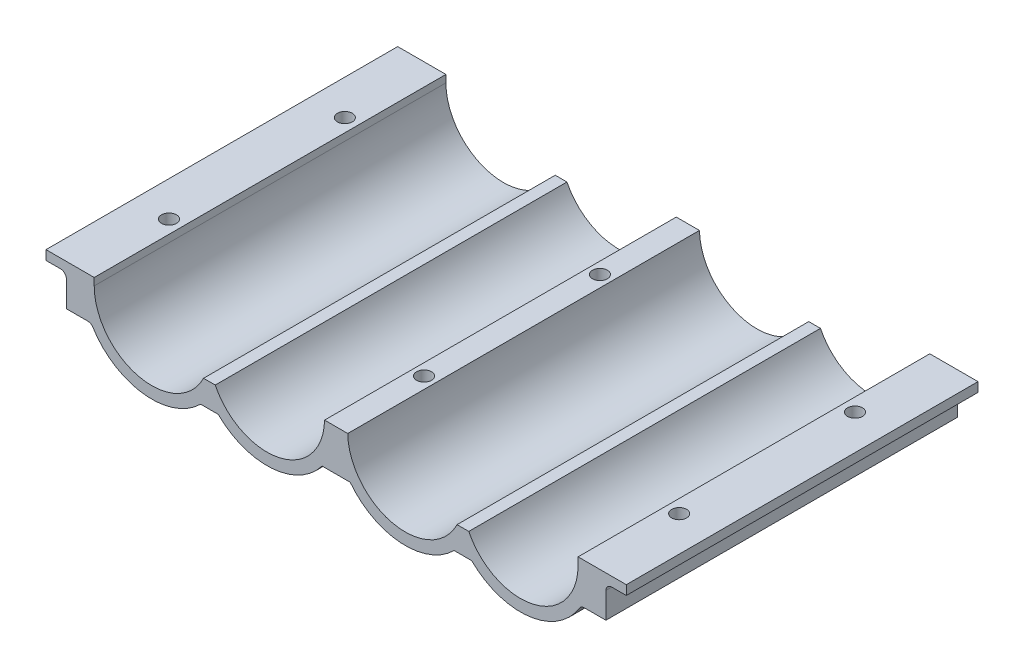
from build123d import *

# Parameters (mm, degrees)
BOSS_EXTRUDE1_DEPTH                         = 60
FILLET1_R                                   = 1
TAPPED_START                                = -7
TAPPED_HOLE_FOR_M2_5X0_45_HELICOIL1_OUTL_R  = 1.275
TAPPED_HOLE_FOR_M2_5X0_45_HELICOIL1_DEPTH   = 7
TAPPED_START_2                              = -8.425
TAPPED_HOLE_FOR_M2_5X0_45_HELICOIL1_2_OU_R  = 1.275
TAPPED_HOLE_FOR_M2_5X0_45_HELICOIL1_2_DEPTH = 1.425


# Read off the part's stored shape, not the designer's step: Tapped Hole for M2.5x0.45 Helicoil1
with BuildPart() as part:
    # Sketch1 → Boss-Extrude1 (new body)
    with BuildSketch(Plane.XY):
        with BuildLine():
            Line((0, 0), (8.225, 0))
            Line((8.225, 0), (8.225, -1.25))
            ThreePointArc((8.225, -1.25), (15.833583974, -10.821735736), (26.875, -5.568564576))
            Line((26.875, -5.568564576), (28.875, -5.568564576))
            ThreePointArc((28.875, -5.568564576), (39.831080274, -10.841095968), (47.523441352, -1.425))
            Line((47.523441352, -1.425), (51.476558648, -1.425))
            ThreePointArc((51.476558648, -1.425), (59.168919726, -10.841095968), (70.125, -5.568564576))
            Line((70.125, -5.568564576), (72.125, -5.568564576))
            ThreePointArc((72.125, -5.568564576), (83.166416026, -10.821735736), (90.775, -1.25))
            Line((90.775, -1.25), (90.775, 0))
            Line((90.775, 0), (99, 0))
            Line((99, 0), (99, -1.6))
            Line((99, -1.6), (95.52, -1.6))
            Line((95.52, -1.6), (95.52, -7))
            Line((95.52, -7), (91.282866253, -7))
            ThreePointArc((91.282866253, -7), (82.611549593, -12.957684568), (72.625, -9.647916408))
            Line((72.625, -9.647916408), (69.625, -9.647916408))
            ThreePointArc((69.625, -9.647916408), (60.486058022, -13.046953991), (51.90053193, -8.425))
            Line((51.90053193, -8.425), (47.09946807, -8.425))
            ThreePointArc((47.09946807, -8.425), (38.513941978, -13.046953991), (29.375, -9.647916408))
            Line((29.375, -9.647916408), (26.375, -9.647916408))
            ThreePointArc((26.375, -9.647916408), (16.388450407, -12.957684568), (7.717133747, -7))
            Line((7.717133747, -7), (3.48, -7))
            Line((3.48, -7), (3.48, -1.6))
            Line((3.48, -1.6), (0, -1.6))
            Line((0, -1.6), (0, 0))
        make_face()
    extrude(amount=BOSS_EXTRUDE1_DEPTH)

    # Fillet1
    fillet1_edges = [part.edges().sort_by_distance(p)[0] for p in [
        (95.52, -1.6, 30),
        (91.282866253, -7, 30),
        (7.717133747, -7, 30),
        (3.48, -1.6, 30),
    ]]
    fillet(fillet1_edges, radius=FILLET1_R)

    # Tapped Hole for M2.5x0.45 Helicoil1 outl → Tapped Hole for M2.5x0.45 Helicoil1 (cut)
    with BuildSketch(Plane(origin=(0, 0, 0), x_dir=(1, 0, 0), z_dir=(0, 1, 0)).offset(TAPPED_START)):
        with Locations((93.02, -15)):
            Circle(TAPPED_HOLE_FOR_M2_5X0_45_HELICOIL1_OUTL_R)
        with Locations((93.02, -45)):
            Circle(TAPPED_HOLE_FOR_M2_5X0_45_HELICOIL1_OUTL_R)
        with Locations((49.5, -15)):
            Circle(TAPPED_HOLE_FOR_M2_5X0_45_HELICOIL1_OUTL_R)
        with Locations((49.5, -45)):
            Circle(TAPPED_HOLE_FOR_M2_5X0_45_HELICOIL1_OUTL_R)
    tapped_hole_for_m2_5x0_45_helicoil1 = extrude(amount=TAPPED_HOLE_FOR_M2_5X0_45_HELICOIL1_DEPTH, mode=Mode.SUBTRACT)

    # Tapped Hole for M2.5x0.45 Helicoil1 2 ou → Tapped Hole for M2.5x0.45 Helicoil1 2 (cut)
    with BuildSketch(Plane(origin=(0, 0, 0), x_dir=(1, 0, 0), z_dir=(0, 1, 0)).offset(TAPPED_START_2)):
        with Locations((49.5, -15)):
            Circle(TAPPED_HOLE_FOR_M2_5X0_45_HELICOIL1_2_OU_R)
        with Locations((49.5, -45)):
            Circle(TAPPED_HOLE_FOR_M2_5X0_45_HELICOIL1_2_OU_R)
    tapped_hole_for_m2_5x0_45_helicoil1_2 = extrude(amount=TAPPED_HOLE_FOR_M2_5X0_45_HELICOIL1_2_DEPTH, mode=Mode.SUBTRACT)

    # Mirror1: Tapped Hole for M2.5x0.45 Helicoil1, Tapped Hole for M2.5x0.45 Helicoil1 2 across plane
    add(tapped_hole_for_m2_5x0_45_helicoil1.mirror(Plane.ZY.offset(-49.5)), mode=Mode.SUBTRACT)
    add(tapped_hole_for_m2_5x0_45_helicoil1_2.mirror(Plane.ZY.offset(-49.5)), mode=Mode.SUBTRACT)


solid = part.part
